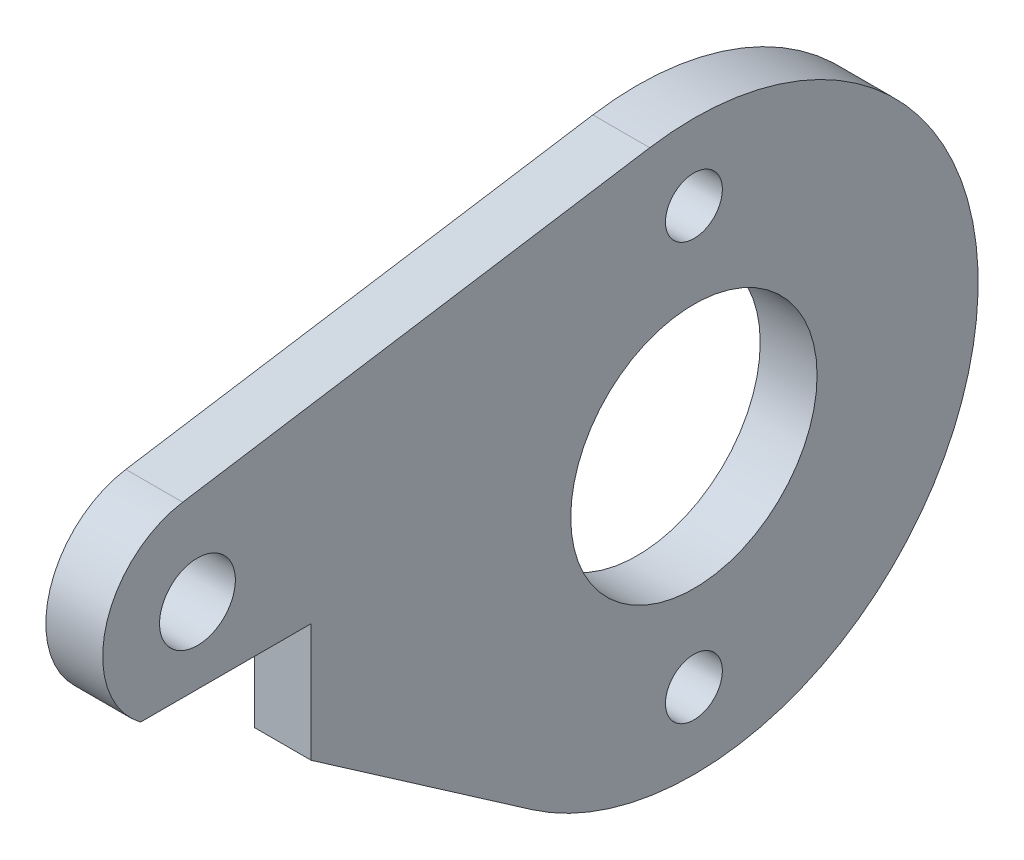
from build123d import *

# Parameters (mm, degrees)
ESQUISSE1_R             = 6.5
ESQUISSE1_R_2           = 1.5
ESQUISSE1_R_3           = 2
BOSS_EXTRU_1_DEPTH      = 3
ENL_V_MAT_EXTRU_1_DEPTH = 35.748237365


with BuildPart() as part:
    # Esquisse1 → Boss.-Extru.1 (new body)
    with BuildSketch(Plane.ZY):
        with BuildLine():
            Line((29.049319561, 1.891304582), (8.547958684, -12.326086254))
            ThreePointArc((8.547958684, -12.326086254), (-14.621490903, -3.348433031), (2.331837562, 14.817642646))
            Line((2.331837562, 14.817642646), (26.977279187, 10.939214215))
            ThreePointArc((26.977279187, 10.939214215), (31.073830301, 7.116144344), (29.049319561, 1.891304582))
        make_face()
        Circle(ESQUISSE1_R, mode=Mode.SUBTRACT)
        with Locations((0, 11)):
            Circle(ESQUISSE1_R_2, mode=Mode.SUBTRACT)
        with Locations((0, -11)):
            Circle(ESQUISSE1_R_2, mode=Mode.SUBTRACT)
        with Locations((26.2, 6)):
            Circle(ESQUISSE1_R_3, mode=Mode.SUBTRACT)
    extrude(amount=-BOSS_EXTRU_1_DEPTH)

    # Esquisse2 → Enlèv. mat.-Extru.1 (cut, through all)
    with BuildSketch(Plane(origin=(3, 0, 0), x_dir=(0, 0, -1), z_dir=(1, 0, 0))):
        Polygon((-29.206057462, 2), (-20.2, 2), (-20.2, -4.245567774), align=None)
    extrude(amount=-ENL_V_MAT_EXTRU_1_DEPTH, mode=Mode.SUBTRACT)


solid = part.part
